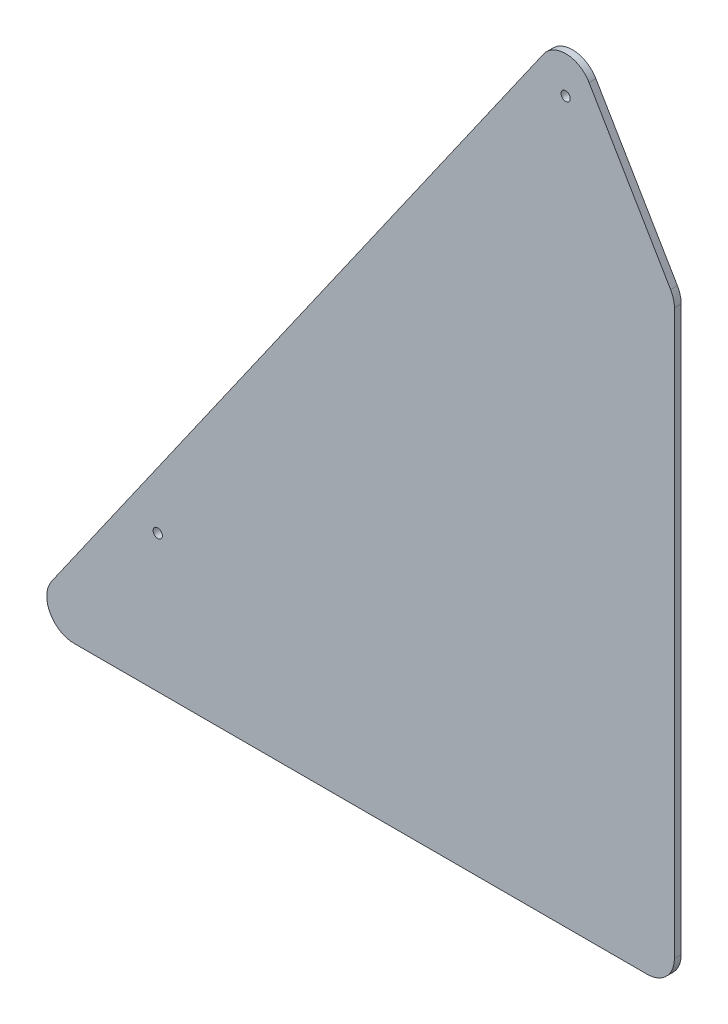
from build123d import *

# Parameters (mm, degrees)
BOSS_EXTRUDE1_DEPTH = 3.175
SKETCH2_R           = 2.159
CUT_EXTRUDE1_DEPTH  = 475.859409022
FILLET1_R           = 12.7


with BuildPart() as part:
    # Sketch1 → Boss-Extrude1 (new body)
    with BuildSketch(Plane.XY):
        Polygon((0, 0), (304.8, 0), (304.8, 279.4), (254.954725958, 364.113083686), align=None)
    extrude(amount=BOSS_EXTRUDE1_DEPTH)

    # Sketch2 → Cut-Extrude1 (cut, through all)
    with BuildSketch(Plane.XY.offset(3.175)):
        with Locations((63.5, 64.117269263)):
            Circle(SKETCH2_R)
        with Locations((254, 336.179464547)):
            Circle(SKETCH2_R)
    extrude(amount=-CUT_EXTRUDE1_DEPTH, mode=Mode.SUBTRACT)

    # Fillet1
    fillet1_edges = [part.edges().sort_by_distance(p)[0] for p in [
        (0, 0, 1.5875),
        (304.8, 0, 1.5875),
        (304.8, 279.4, 1.5875),
        (254.954725958, 364.113083686, 1.5875),
    ]]
    fillet(fillet1_edges, radius=FILLET1_R)


solid = part.part
